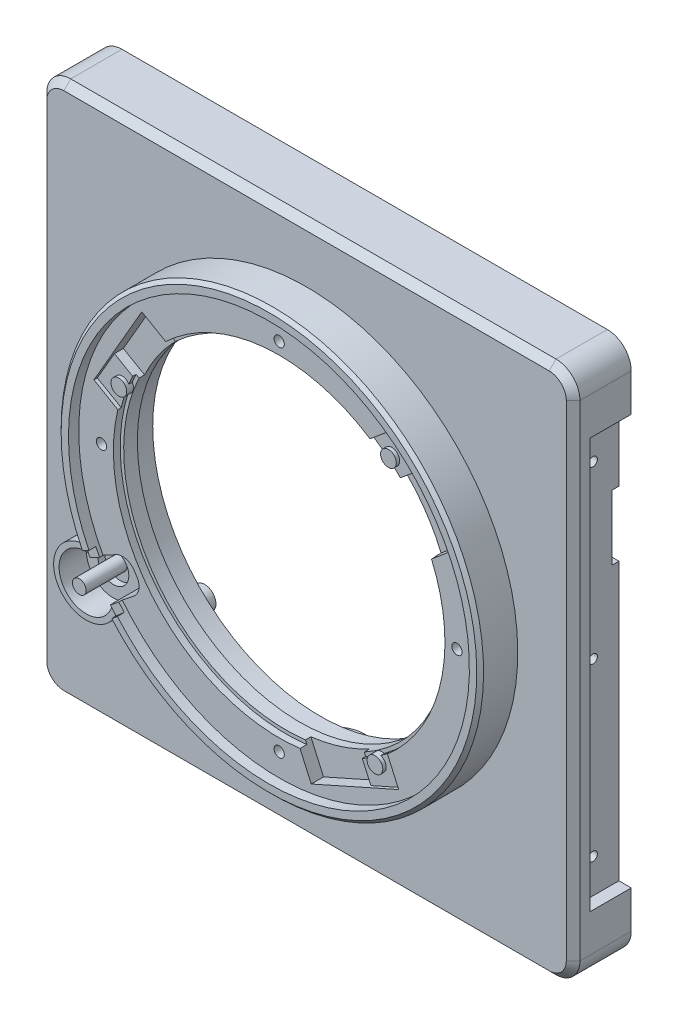
from build123d import *

# Parameters (mm, degrees)
SKETCH_1_W           = 78
SKETCH_1_H           = 78
SKETCH_1_R           = 23.75
EXTRUDE_1_DEPTH      = 2
EXTRUDE_START        = 4
SKETCH_2_R           = 30.9
SKETCH_2_R_2         = 23.750000000000004
EXTRUDE_2_DEPTH      = 4
SKETCH_3_W           = 78
SKETCH_3_H           = 78
SKETCH_3_W_2         = 74.00000000000007
SKETCH_3_H_2         = 73.99999999999996
EXTRUDE_3_DEPTH      = 6.5
SKETCH_4_R           = 0.7500000000000002
SKETCH_4_R_2         = 0.750000000000002
SKETCH_4_R_3         = 0.7500000000000004
CUT_EXTRUDE_1_DEPTH  = 5
CUT_EXTRUDE_2_DEPTH  = 4
EXTRUDE_START_2      = 1.5
EXTRUDE_5_DEPTH      = 1.5
CHAMFER_1_SIZE       = 0.5
SKETCH_9_R           = 1.6499999999999986
SKETCH_9_R_2         = 0.7999999999999987
EXTRUDE_6_DEPTH      = 2.1
CUT_EXTRUDE_START    = -2
SKETCH_9_2_R         = 0.7999999999999987
CUT_EXTRUDE_4_DEPTH  = 2
SKETCH_10_R          = 0.800000000000003
CUT_EXTRUDE_5_DEPTH  = 4
SKETCH_18_R          = 4.25
SKETCH_18_R_2        = 2.5527000000000006
EXTRUDE_9_DEPTH      = 9
SKETCH_18_4_R        = 2.5527000000000006
CUT_EXTRUDE_9_DEPTH  = 7.5
EXTRUDE_10_DEPTH     = 3.9999999999999964
SKETCH_31_R          = 2.2499999999999987
SKETCH_31_R_2        = 1.0000000000000018
CUT_EXTRUDE_19_DEPTH = 1
EXTRUDE_START_3      = 5
SKETCH_32_R          = 1.0000000000000018
EXTRUDE_11_DEPTH     = 5
EXTRUDE_START_4      = 0.5
EXTRUDE_12_DEPTH     = 0.5
FILLET_5_R           = 1
FILLET_2_R           = 1.5
FILLET_3_R           = 3.5
CHAMFER_2_SIZE       = 1
SKETCH_11_R          = 24.25
CUT_EXTRUDE_6_DEPTH  = 1
CUT_EXTRUDE_10_DEPTH = 1.8
SKETCH_12_W          = 29.000000000000004
SKETCH_12_H          = 1
CUT_EXTRUDE_7_DEPTH  = 1
SKETCH_21_R          = 24.5
CUT_EXTRUDE_12_DEPTH = 3
CUT_EXTRUDE_14_DEPTH = 1
SKETCH_24_R          = 0.6500000000000002
SKETCH_24_R_2        = 0.65
CUT_EXTRUDE_15_DEPTH = 4.75
SKETCH_26_R          = 4.25
SKETCH_26_W          = 1.3999999999999995
SKETCH_26_H          = 11.500000000000004
CUT_EXTRUDE_17_DEPTH = 10
SKETCH_29_R          = 0.8000000000000004
SKETCH_29_R_2        = 0.7999999999999987
CUT_EXTRUDE_18_DEPTH = 3
FILLET_6_R           = 0.5
CUT_EXTRUDE_20_DEPTH = 0.5
CUT_EXTRUDE_21_DEPTH = 1.8
SKETCH_35_R          = 1.1500000000000052
SKETCH_35_R_2        = 1.1499999999999992
SKETCH_35_R_3        = 1.1499999999999997
EXTRUDE_13_DEPTH     = 1
SKETCH_36_R          = 5.8
CUT_EXTRUDE_22_DEPTH = 3.9999999999999964
FILLET_7_R           = 0.5


with BuildPart() as part:
    # 草图1 → 凸台-拉伸1 (new body)
    with BuildSketch(Plane.XY):
        Rectangle(SKETCH_1_W, SKETCH_1_H)
        Circle(SKETCH_1_R, mode=Mode.SUBTRACT)
    extrude(amount=-EXTRUDE_1_DEPTH)

    # 草图2 → 凸台-拉伸2 (add)
    with BuildSketch(Plane.XY.offset(EXTRUDE_START)):
        with Locations(Location((0, 0, 0), (0, 0, 180))):
            Circle(SKETCH_2_R)
        Circle(SKETCH_2_R_2, mode=Mode.SUBTRACT)
    extrude(amount=-EXTRUDE_2_DEPTH)

    # 草图3 → 凸台-拉伸3 (add)
    # profile 1 of 6: a face of its own
    with BuildSketch(Plane(origin=(0, 0, -2), x_dir=(-1, 0, 0), z_dir=(0, 0, -1))):
        Rectangle(SKETCH_3_W, SKETCH_3_H)
        Rectangle(SKETCH_3_W_2, SKETCH_3_H_2, mode=Mode.SUBTRACT)
    # profile 2 of 6: a face of its own
    with BuildSketch(Plane(origin=(0, 0, -2), x_dir=(-1, 0, 0), z_dir=(0, 0, -1))):
        Polygon((-37.00000000000004, 37), (-37.00000000000004, 32), (-35.500000000000036, 32), (-32, 32), (-32, 37), align=None)
    # profile 3 of 6: a face of its own
    with BuildSketch(Plane(origin=(0, 0, -2), x_dir=(-1, 0, 0), z_dir=(0, 0, -1))):
        Polygon((-37.00000000000004, 32), (-37.00000000000004, -32.000000000000014), (-35.50000000000003, -32.000000000000014), (-35.500000000000036, 32), align=None)
    # profile 4 of 6: a face of its own
    with BuildSketch(Plane(origin=(0, 0, -2), x_dir=(-1, 0, 0), z_dir=(0, 0, -1))):
        Polygon((-37.00000000000004, -32.000000000000014), (-37.00000000000004, -36.99999999999996), (-32.00000000000001, -36.99999999999996), (-32.00000000000001, -32.000000000000014), (-35.50000000000003, -32.000000000000014), align=None)
    # profile 5 of 6: a face of its own
    with BuildSketch(Plane(origin=(0, 0, -2), x_dir=(-1, 0, 0), z_dir=(0, 0, -1))):
        Polygon((32.000000000000014, -32.000000000000014), (32.000000000000014, -37.00000000000001), (37.00000000000003, -36.99999999999996), (37.00000000000003, -32.000000000000014), align=None)
    # profile 6 of 6: a face of its own
    with BuildSketch(Plane(origin=(0, 0, -2), x_dir=(-1, 0, 0), z_dir=(0, 0, -1))):
        Polygon((31.999999999999993, 32), (36.99999999999999, 32), (37.00000000000003, 37), (31.999999999999986, 37), align=None)
    extrude(amount=EXTRUDE_3_DEPTH)

    # 草图4 → 切除-拉伸1 (cut)
    with BuildSketch(Plane.XY.offset(4)):
        with Locations((6.51e-15, 26)):
            Circle(SKETCH_4_R)
        with Locations((26, 0)):
            Circle(SKETCH_4_R_2)
        with Locations((6.48e-15, -26)):
            Circle(SKETCH_4_R_3)
        with Locations((-26, 0)):
            Circle(SKETCH_4_R_2)
    extrude(amount=-CUT_EXTRUDE_1_DEPTH, mode=Mode.SUBTRACT)

    # 草图5 → 切除-拉伸2 (cut)
    with BuildSketch(Plane.XY.offset(4)):
        with BuildLine():
            Line((-27.97481984312372, -13.719309557873958), (-23.559323960627246, -20.3903961344113))
            Line((-23.559323960627246, -20.3903961344113), (-22.64439875827279, -19.59853609035649))
            Line((-22.64439875827279, -19.59853609035649), (-23.33224850828913, -18.559308480112588))
            Line((-23.33224850828913, -18.559308480112588), (-21.244768304781633, -16.898851750909657))
            ThreePointArc((-21.244768304781633, -16.898851750909657), (-20.5144208968666, -15.64650436728529), (-20.82202593392254, -14.229761466580714))
            Line((-20.82202593392254, -14.229761466580714), (-21.234378184052506, -13.606765174918065))
            ThreePointArc((-21.234378184052506, -13.606765174918065), (-22.41830603698751, -12.770047692990193), (-23.856467348706058, -12.953004920218257))
            Line((-23.856467348706058, -12.953004920218257), (-26.200569322500627, -14.225748447423724))
            Line((-26.200569322500627, -14.225748447423724), (-26.888419072516967, -13.186520837179826))
            Line((-26.888419072516967, -13.186520837179826), (-27.97481984312372, -13.719309557873958))
        make_face()
    extrude(amount=-CUT_EXTRUDE_2_DEPTH, mode=Mode.SUBTRACT)

    # 草图8 → 凸台-拉伸5 (add)
    with BuildSketch(Plane.XY.offset(4).offset(EXTRUDE_START_2)):
        with BuildLine():
            ThreePointArc((30.9, 0), (-6.983586682407516, 30.1004903124401), (-27.74333443684792, -13.605785325559426))
            Line((-27.74333443684792, -13.605785325559431), (-26.888419072516967, -13.186520837179824))
            Line((-26.888419072516967, -13.186520837179824), (-26.329232438853243, -12.91228655896538))
            ThreePointArc((-26.329232438853243, -12.912286558965379), (-6.6276271670420845, 28.56624201981573), (29.325, 0))
            ThreePointArc((29.325, -7.18e-15), (10.24008117356817, -27.479016768413217), (-22.173473149785824, -19.190953949080466))
            Line((-22.17347314978582, -19.190953949080473), (-22.644398758272786, -19.598536090356493))
            Line((-22.644398758272786, -19.598536090356493), (-23.36437579977431, -20.22167014583415))
            ThreePointArc((-23.364375799774322, -20.221670145834146), (10.790059957826307, -28.95487188896738), (30.9, -7.57e-15))
        make_face()
    extrude(amount=-EXTRUDE_5_DEPTH)

    # 倒角1
    chamfer_1_edges = [part.edges().sort_by_distance(p)[0] for p in [
        (25.767071901875468, 17.054852846142637, 5.5),
    ]]
    chamfer(chamfer_1_edges, length=CHAMFER_1_SIZE)

    # 草图9 → 凸台-拉伸6 (add)
    # profile 1 of 3: a face of its own
    with BuildSketch(Plane(origin=(0, 0, -2), x_dir=(-1, 0, 0), z_dir=(0, 0, -1))):
        with Locations((-19, -20)):
            Circle(SKETCH_9_R)
        with Locations((-19, -20)):
            Circle(SKETCH_9_R_2, mode=Mode.SUBTRACT)
    # profile 2 of 3: a face of its own
    with BuildSketch(Plane(origin=(0, 0, -2), x_dir=(-1, 0, 0), z_dir=(0, 0, -1))):
        with Locations((19, 20)):
            Circle(SKETCH_9_R)
        with Locations((19, 20)):
            Circle(SKETCH_9_R_2, mode=Mode.SUBTRACT)
    # profile 3 of 3: a face of its own
    with BuildSketch(Plane(origin=(0, 0, -2), x_dir=(-1, 0, 0), z_dir=(0, 0, -1))):
        with Locations((19, -20)):
            Circle(SKETCH_9_R)
        with Locations((19, -20)):
            Circle(SKETCH_9_R_2, mode=Mode.SUBTRACT)
    extrude(amount=EXTRUDE_6_DEPTH)

    # 草图9<2> → 切除-拉伸4 (cut)
    with BuildSketch(Plane(origin=(0, 0, -2), x_dir=(-1, 0, 0), z_dir=(0, 0, -1)).offset(CUT_EXTRUDE_START)):
        with Locations((-19, -20)):
            Circle(SKETCH_9_2_R)
        with Locations((19, 20)):
            Circle(SKETCH_9_2_R)
        with Locations((19, -20)):
            Circle(SKETCH_9_2_R)
    extrude(amount=CUT_EXTRUDE_4_DEPTH, mode=Mode.SUBTRACT)

    # 草图10 → 切除-拉伸5 (cut)
    with BuildSketch(Plane(origin=(0, 0, -8.5), x_dir=(-1, 0, 0), z_dir=(0, 0, -1))):
        with Locations((-34.50000000000001, 34.5)):
            Circle(SKETCH_10_R)
        with Locations((34.49999999999999, 34.5)):
            Circle(SKETCH_10_R)
        with Locations((34.49999999999999, -34.49999999999999)):
            Circle(SKETCH_10_R)
        with Locations((-34.50000000000001, -34.49999999999999)):
            Circle(SKETCH_10_R)
    extrude(amount=-CUT_EXTRUDE_5_DEPTH, mode=Mode.SUBTRACT)

    # 草图18 → 凸台-拉伸9 (add)
    # profile 1 of 2: a face of its own
    with BuildSketch(Plane.XZ.offset(39)):
        with Locations((0, -4.25)):
            Circle(SKETCH_18_R)
        with Locations((0, -4.25)):
            Circle(SKETCH_18_R_2, mode=Mode.SUBTRACT)
    # profile 2 of 2: a face of its own
    with BuildSketch(Plane.XZ.offset(39)):
        with Locations((0, -4.25)):
            Circle(SKETCH_18_R_2)
    extrude(amount=-EXTRUDE_9_DEPTH)

    # 草图18<4> → 切除-拉伸9 (cut)
    with BuildSketch(Plane.XZ.offset(39)):
        with Locations(Location((0, -4.25, 0), (0, 0, 270))):
            Circle(SKETCH_18_4_R)
    extrude(amount=-CUT_EXTRUDE_9_DEPTH, mode=Mode.SUBTRACT)

    # 草图30 → 凸台-拉伸10 (add)
    with BuildSketch(Plane.XY):
        with BuildLine():
            Line((-26.200569322500627, -14.225748447423724), (-26.888419072516967, -13.186520837179824))
            Line((-26.888419072516967, -13.186520837179824), (-27.743334436847917, -13.605785325559427))
            Line((-27.743334436847917, -13.605785325559427), (-28.44506525893139, -13.949925607014391))
            ThreePointArc((-28.445065258931386, -13.949925607014452), (-27.39391103483802, -14.02285246445049), (-26.38469650504792, -14.325721350646106))
            Line((-26.384696505047916, -14.325721350646141), (-26.200569322500627, -14.225748447423724))
        make_face()
        with BuildLine():
            ThreePointArc((-23.496214450881233, -18.69576150347539), (-23.612418925892246, -19.74000239167697), (-23.955346675130514, -20.733150452847607))
            Line((-23.955346675130457, -20.73315045284763), (-23.36437579977431, -20.22167014583415))
            Line((-23.36437579977431, -20.22167014583415), (-22.64439875827279, -19.59853609035649))
            Line((-22.64439875827279, -19.59853609035649), (-23.33224850828913, -18.559308480112588))
            Line((-23.33224850828913, -18.559308480112588), (-23.49621827274124, -18.689735920005358))
            ThreePointArc((-23.49621827274131, -18.68973592000531), (-23.496215406346348, -18.692748711134325), (-23.496214450881233, -18.69576150347539))
        make_face()
        with BuildLine():
            ThreePointArc((-26.38469650504792, -14.325721350646106), (-27.39391103483802, -14.02285246445049), (-28.445065258931386, -13.949925607014452))
            ThreePointArc((-28.445065258931386, -13.949925607014452), (-32.20717210570015, -21.317462183707647), (-23.955346675130514, -20.733150452847607))
            ThreePointArc((-23.955346675130514, -20.733150452847607), (-23.612418925892246, -19.74000239167697), (-23.496214450881233, -18.69576150347539))
            ThreePointArc((-23.496214450881233, -18.69576150347539), (-23.496215406346348, -18.692748711134325), (-23.49621827274131, -18.68973592000531))
            Line((-23.49621827274124, -18.689735920005358), (-24.354625339008635, -19.37254373163591))
            ThreePointArc((-24.354625339008546, -19.37254373163593), (-31.540063448046517, -20.87591259545785), (-27.34863077133443, -14.849094954603387))
            Line((-27.34863077133438, -14.84909495460317), (-26.384696505047916, -14.325721350646141))
        make_face()
    extrude(amount=EXTRUDE_10_DEPTH)

    # 草图31 → 切除-拉伸19 (cut)
    with BuildSketch(Plane.XY):
        with Locations((-28.246214450881293, -18.695761503475197)):
            Circle(SKETCH_31_R)
        with Locations((-28.246214450881293, -18.695761503475197)):
            Circle(SKETCH_31_R_2, mode=Mode.SUBTRACT)
    extrude(amount=-CUT_EXTRUDE_19_DEPTH, mode=Mode.SUBTRACT)

    # 草图32 → 凸台-拉伸11 (add)
    with BuildSketch(Plane.XY.offset(EXTRUDE_START_3)):
        with Locations((-28.246214450881293, -18.695761503475197)):
            Circle(SKETCH_32_R)
    extrude(amount=-EXTRUDE_11_DEPTH)

    # 草图33 → 凸台-拉伸12 (add)
    with BuildSketch(Plane.XY.offset(4).offset(EXTRUDE_START_4)):
        with BuildLine():
            ThreePointArc((-25.771311828812117, -13.992680644613037), (-26.05587248763348, -13.455375650950238), (-26.329232438853243, -12.912286558965377))
            Line((-26.329232438853243, -12.91228655896538), (-27.74333443684792, -13.605785325559431))
            ThreePointArc((-27.743334436847924, -13.605785325559427), (-27.455292749117636, -14.178042885400254), (-27.15544878125472, -14.744205692021925))
            Line((-27.155448781254716, -14.74420569202192), (-25.771311828812117, -13.992680644613039))
        make_face()
        with BuildLine():
            Line((-23.36437579977431, -20.22167014583415), (-22.17347314978582, -19.190953949080473))
            ThreePointArc((-22.17347314978582, -19.190953949080463), (-22.566579052591102, -18.727122973461682), (-22.949984199697017, -18.255241719398217))
            Line((-22.94998419969701, -18.255241719398217), (-24.182592046739526, -19.23570227210253))
            ThreePointArc((-24.182592046739526, -19.235702272102525), (-23.77859480733383, -19.732927532138685), (-23.364375799774322, -20.22167014583415))
        make_face()
    extrude(amount=-EXTRUDE_12_DEPTH)

    # 圆角5
    fillet_5_edges = [part.edges().sort_by_distance(p)[0] for p in [
        (3.605551275463989, -33.49999999999998, -2),
        (-3.605551275463989, -33.49999999999998, -2),
    ]]
    fillet(fillet_5_edges, radius=FILLET_5_R)

    # 圆角2
    fillet_2_edges = [part.edges().sort_by_distance(p)[0] for p in [
        (32.00000000000001, -32.000000000000014, -5.25),
        (35.50000000000003, -32.000000000000014, -5.25),
        (35.500000000000036, 32, -5.25),
        (32, 32, -5.25),
        (32, 37, -5.25),
        (-31.99999999999999, 37, -5.25),
        (-31.999999999999993, 32, -5.25),
        (-37.000000000000014, 32, -5.25),
        (-37.000000000000014, -32.000000000000014, -5.25),
        (-32.000000000000014, -32.000000000000014, -5.25),
        (-32.000000000000014, -36.999999999999986, -5.25),
        (32.00000000000001, -36.999999999999986, -5.25),
    ]]
    fillet(fillet_2_edges, radius=FILLET_2_R)

    # 圆角3
    fillet_3_edges = [part.edges().sort_by_distance(p)[0] for p in [
        (38.99999999999999, -39, -4.25),
        (-39.00000000000001, -39, -4.25),
        (-39.00000000000001, 39, -4.25),
        (38.99999999999999, 39, -4.25),
    ]]
    fillet(fillet_3_edges, radius=FILLET_3_R)

    # 倒角2
    # the kernel refuses this chamfer: 1 mm, written as the material it takes off along each edge
    with BuildSketch(Plane(origin=(-35.50000000000001, -39, 0), x_dir=(0, -0.02749587661058908, -0.9996219169112968), z_dir=(1, 0, 0))) as chamfer_2_piece_1:
        Polygon((CHAMFER_2_SIZE * 0.999621916911, CHAMFER_2_SIZE * 0.0274958766106), (-CHAMFER_2_SIZE * 0.0274958766106, CHAMFER_2_SIZE * 0.999621916911), (0, 0), align=None)
    extrude(amount=35.50000000000025, mode=Mode.SUBTRACT)
    with BuildSketch(Plane(origin=(38.99999999999999, -35.5, 0), x_dir=(0.02749587661058908, 0, -0.9996219169112968), z_dir=(0, 1, 0)), Plane(origin=(35.49999999999999, 39, 0), x_dir=(0, 0.02749587661058908, -0.9996219169112968), z_dir=(-1, 0, 0)), Plane(origin=(-39.00000000000001, 35.5, 0), x_dir=(-0.02749587661058908, 0, -0.9996219169112968), z_dir=(0, -1, 0))) as chamfer_2_piece_2:
        Polygon((CHAMFER_2_SIZE * 0.999621916911, CHAMFER_2_SIZE * 0.0274958766106), (-CHAMFER_2_SIZE * 0.0274958766106, CHAMFER_2_SIZE * 0.999621916911), (0, 0), align=None)
    extrude(amount=71, mode=Mode.SUBTRACT)
    with BuildSketch(Plane(origin=(35.49999999999999, 35.5, 0), x_dir=(1, 0, 0), z_dir=(0, -1, 0))) as chamfer_2_piece_3:
        Polygon((3.5, -CHAMFER_2_SIZE), (3.5 - CHAMFER_2_SIZE, 0), (3.5, 0), align=None)
    revolve(axis=Axis((35.49999999999999, 35.5, 0), (0, 0, 1)), revolution_arc=90, mode=Mode.SUBTRACT)
    with BuildSketch(Plane(origin=(-35.50000000000001, 35.5, 0), x_dir=(-1, 0, 0), z_dir=(0, -1, 0))) as chamfer_2_piece_4:
        Polygon((3.5, CHAMFER_2_SIZE), (3.5 - CHAMFER_2_SIZE, 0), (3.5, 0), align=None)
    revolve(axis=Axis((-35.50000000000001, 35.5, 0), (0, 0, -1)), revolution_arc=90, mode=Mode.SUBTRACT)
    with BuildSketch(Plane(origin=(-35.50000000000001, -35.5, 0), x_dir=(-1, 0, 0), z_dir=(0, 1, 0))) as chamfer_2_piece_5:
        Polygon((3.5, -CHAMFER_2_SIZE), (3.5 - CHAMFER_2_SIZE, 0), (3.5, 0), align=None)
    revolve(axis=Axis((-35.50000000000001, -35.5, 0), (0, 0, 1)), revolution_arc=90, mode=Mode.SUBTRACT)
    with BuildSketch(Plane(origin=(35.49999999999999, -35.5, 0), x_dir=(0, -1, 0), z_dir=(-1, 0, 0))) as chamfer_2_piece_6:
        Polygon((3.5, -CHAMFER_2_SIZE), (3.5 - CHAMFER_2_SIZE, 0), (3.5, 0), align=None)
    revolve(axis=Axis((35.49999999999999, -35.5, 0), (0, 0, 1)), revolution_arc=90, mode=Mode.SUBTRACT)
    with BuildSketch(Plane(origin=(2.4158e-13, -39, 0), x_dir=(0, -0.02749587661058908, -0.9996219169112968), z_dir=(1, 0, 0))) as chamfer_2_piece_7:
        Polygon((CHAMFER_2_SIZE * 0.999621916911, CHAMFER_2_SIZE * 0.0274958766106), (-CHAMFER_2_SIZE * 0.0274958766106, CHAMFER_2_SIZE * 0.999621916911), (0, 0), align=None)
    extrude(amount=35.49999999999975, mode=Mode.SUBTRACT)

    # 草图11 → 切除-拉伸6 (cut)
    with BuildSketch(Plane.XY.offset(4)):
        Circle(SKETCH_11_R)
    extrude(amount=-CUT_EXTRUDE_6_DEPTH, mode=Mode.SUBTRACT)

    # 草图19 → 切除-拉伸10 (cut)
    with BuildSketch(Plane.ZY.offset(-38.99999999999999)):
        Polygon((-8.5, 30), (-2.500000000000001, 30), (-2.4999999999999933, -30), (-8.499999999999993, -30), align=None)
    extrude(amount=CUT_EXTRUDE_10_DEPTH, mode=Mode.SUBTRACT)

    # 草图12 → 切除-拉伸7 (cut)
    with BuildSketch(Plane(origin=(0, 0, -8.5), x_dir=(-1, 0, 0), z_dir=(0, 0, -1))):
        Polygon((-3.5, -37.999999999999964), (-3.5000000000000013, -36.99999999999996), (-14.5, -36.999999999999964), (-14.500000000000002, -37.999999999999964), align=None)
        Polygon((14.500000000000002, -37.999999999999964), (14.5, -36.999999999999964), (3.5000000000000018, -36.999999999999964), (3.5, -37.999999999999964), align=None)
        with Locations((0, 37.5)):
            Rectangle(SKETCH_12_W, SKETCH_12_H)
    extrude(amount=-CUT_EXTRUDE_7_DEPTH, mode=Mode.SUBTRACT)

    # 草图21 → 切除-拉伸12 (cut)
    with BuildSketch(Plane(origin=(0, 0, -2), x_dir=(-1, 0, 0), z_dir=(0, 0, -1))):
        Circle(SKETCH_21_R)
    extrude(amount=-CUT_EXTRUDE_12_DEPTH, mode=Mode.SUBTRACT)

    # 草图23 → 切除-拉伸14 (cut)
    with BuildSketch(Plane(origin=(0, 0, -8.5), x_dir=(-1, 0, 0), z_dir=(0, 0, -1))):
        Polygon((-35.500000000000036, 19.999999999999996), (-37.19999999999999, 20), (-37.19999999999999, 10.500000000000002), (-35.500000000000036, 10.499999999999996), align=None)
    extrude(amount=-CUT_EXTRUDE_14_DEPTH, mode=Mode.SUBTRACT)

    # 草图24 → 切除-拉伸15 (cut)
    with BuildSketch(Plane(origin=(37.19999999999999, 0, 0), x_dir=(0, 0, -1), z_dir=(1, 0, 0))):
        with Locations((4.700000000000001, -25.000000000000014)):
            Circle(SKETCH_24_R)
        with Locations((4.699999999999915, -1.388e-14)):
            Circle(SKETCH_24_R_2)
        with Locations((4.69999999999983, 24.999999999999986)):
            Circle(SKETCH_24_R)
    extrude(amount=-CUT_EXTRUDE_15_DEPTH, mode=Mode.SUBTRACT)

    # 草图26 → 切除-拉伸17 (cut)
    with BuildSketch(Plane(origin=(-39.00000000000001, 0, 0), x_dir=(0, 0, -1), z_dir=(1, 0, 0))):
        with Locations((9.000000000000002, -10.199999999999994)):
            Circle(SKETCH_26_R)
        with Locations((6.5, -24.25)):
            Rectangle(SKETCH_26_W, SKETCH_26_H)
        with BuildLine():
            Line((12.7, 0.6000000000000073), (7.7, 0.6000000000000066))
            ThreePointArc((7.7, 0.6000000000000066), (5.6, 2.700000000000008), (7.7, 4.800000000000008))
            Line((7.7, 4.800000000000008), (12.7, 4.800000000000008))
            ThreePointArc((12.7, 4.800000000000008), (14.8, 2.700000000000008), (12.7, 0.6000000000000073))
        make_face()
        with BuildLine():
            Line((8.5, 29.5), (8.5, 20.4))
            Line((8.5, 20.4), (6.300000000000001, 20.4))
            ThreePointArc((6.300000000000001, 20.4), (5.4514718625761445, 20.751471862576143), (5.100000000000002, 21.599999999999998))
            Line((5.100000000000002, 21.599999999999998), (5.1000000000000005, 28.299999999999997))
            ThreePointArc((5.1000000000000005, 28.299999999999997), (5.451471862576142, 29.148528137423856), (6.300000000000001, 29.5))
            Line((6.300000000000001, 29.5), (8.5, 29.5))
        make_face()
        Polygon((8.5, 13.999999999999998), (5.100000000000002, 13.999999999999998), (5.100000000000003, 5.999999999999998), (8.500000000000002, 5.999999999999998), align=None)
    extrude(amount=CUT_EXTRUDE_17_DEPTH, mode=Mode.SUBTRACT)

    # 草图29 → 切除-拉伸18 (cut)
    with BuildSketch(Plane(origin=(0, 0, -2), x_dir=(-1, 0, 0), z_dir=(0, 0, -1))):
        with Locations((-15, 22)):
            Circle(SKETCH_29_R)
        with Locations((15, -22)):
            Circle(SKETCH_29_R_2)
    extrude(amount=-CUT_EXTRUDE_18_DEPTH, mode=Mode.SUBTRACT)

    # 圆角6
    fillet_6_edges = [part.edges().sort_by_distance(p)[0] for p in [
        (-23.36437579977402, -20.221670145834494, 1.9999999999999982),
        (-27.743334436847938, -13.605785325559381, 1.9999999999999982),
    ]]
    fillet(fillet_6_edges, radius=FILLET_6_R)

    # 草图34 → 切除-拉伸20 (cut)
    with BuildSketch(Plane.XY.offset(4)):
        with BuildLine():
            Line((17.478391727313628, -22.046957219230375), (15.838315503483965, -18.36328570850293))
            ThreePointArc((15.83831550348363, -18.363285708502985), (13.823905584345479, -19.92390861239586), (11.656851981138184, -21.264531546446886))
            Line((11.65685198113835, -21.26453154644683), (12.910664439100614, -24.08064043460935))
            Line((12.910664439100614, -24.08064043460935), (17.478391727313628, -22.046957219230375))
        make_face()
        with BuildLine():
            Line((15.838315503483965, -18.36328570850293), (15.24134019039676, -17.02245720219606))
            Line((15.24134019039676, -17.02245720219606), (10.673612902183741, -19.056140417575033))
            Line((10.673612902183741, -19.056140417575033), (11.65685198113835, -21.26453154644683))
            ThreePointArc((11.656851981138184, -21.264531546446886), (13.823905584345479, -19.92390861239586), (15.83831550348363, -18.363285708502985))
        make_face()
        with BuildLine():
            ThreePointArc((13.286291757179338, 20.28637353848904), (15.341705400138268, 18.780164413959966), (17.227715800439647, 17.066584552841324))
            Line((17.227715800440052, 17.06658455284075), (19.5891358556191, 19.048051250196117))
            Line((19.5891358556191, 19.048051250196117), (16.375197807186417, 22.878273465791008))
            Line((16.375197807186417, 22.878273465791008), (13.286291757179416, 20.286373538488878))
        make_face()
        with BuildLine():
            Line((15.37589141846472, 15.512719396920158), (17.227715800440052, 17.06658455284075))
            ThreePointArc((17.227715800439647, 17.066584552841324), (15.341705400138268, 18.780164413959966), (13.286291757179338, 20.28637353848904))
            Line((13.286291757179416, 20.286373538488878), (12.16195337003203, 19.342941612515055))
            Line((12.16195337003203, 19.342941612515055), (15.375891418464722, 15.512719396920158))
        make_face()
        with BuildLine():
            Line((-27.099192253125917, 7.562822173509051), (-23.60713492768148, 5.54668193663808))
            ThreePointArc((-23.60713492768187, 5.546681936637684), (-22.894754196759738, 7.993292830239138), (-21.929569393563796, 10.351641715827979))
            Line((-21.929569393563657, 10.35164171582818), (-24.599192253125896, 11.892949192431232))
            Line((-24.599192253125896, 11.892949192431233), (-27.099192253125917, 7.562822173509051))
        make_face()
        with BuildLine():
            ThreePointArc((-21.929569393563796, 10.351641715827979), (-22.894754196759738, 7.993292830239138), (-23.60713492768187, 5.546681936637684))
            Line((-23.60713492768148, 5.54668193663808), (-22.336052532311516, 4.812822173509032))
            Line((-22.336052532311516, 4.812822173509032), (-19.8360525323115, 9.142949192431214))
            Line((-19.8360525323115, 9.142949192431214), (-21.929569393563657, 10.35164171582818))
        make_face()
    extrude(amount=-CUT_EXTRUDE_20_DEPTH, mode=Mode.SUBTRACT)

    # 草图34<3> → 切除-拉伸21 (cut)
    with BuildSketch(Plane.XY.offset(4)):
        with BuildLine():
            Line((11.65685198113835, -21.26453154644683), (10.673612902183741, -19.056140417575033))
            Line((10.673612902183741, -19.056140417575033), (2.4517037834003172, -22.716770205257184))
            Line((2.451703783400318, -22.716770205257184), (3.0486790964874735, -24.057598711563944))
            ThreePointArc((3.048679096487558, -24.057598711563877), (7.484214528991522, -23.066188087415576), (11.656851981138184, -21.264531546446886))
        make_face()
        with BuildLine():
            Line((12.910664439100614, -24.08064043460935), (11.65685198113835, -21.26453154644683))
            ThreePointArc((11.656851981138184, -21.264531546446886), (7.484214528991522, -23.066188087415576), (3.048679096487558, -24.057598711563877))
            Line((3.0486790964874735, -24.057598711563944), (4.688755320317184, -27.741270222291504))
            Line((4.688755320317184, -27.741270222291504), (12.910664439100614, -24.08064043460935))
        make_face()
        with BuildLine():
            Line((-24.599192253125896, 11.892949192431232), (-21.929569393563657, 10.35164171582818))
            ThreePointArc((-21.929569393563796, 10.351641715827979), (-19.612821927889172, 14.261827233033978), (-16.607134927681265, 17.671037589620735))
            Line((-16.607134927681418, 17.671037589620184), (-20.09919225312586, 19.687177826491162))
            Line((-20.09919225312586, 19.687177826491162), (-24.599192253125896, 11.892949192431233))
        make_face()
        with BuildLine():
            ThreePointArc((-16.607134927681265, 17.671037589620735), (-19.612821927889172, 14.261827233033978), (-21.929569393563796, 10.351641715827979))
            Line((-21.929569393563657, 10.35164171582818), (-19.8360525323115, 9.142949192431214))
            Line((-19.8360525323115, 9.142949192431214), (-18.836052532311488, 10.875000000000089))
            Line((-18.836052532311488, 10.875000000000089), (-15.336052532311461, 16.937177826491137))
            Line((-15.336052532311461, 16.937177826491137), (-16.607134927681418, 17.671037589620184))
        make_face()
        with BuildLine():
            ThreePointArc((17.227715800439647, 17.066584552841324), (20.10971397660282, 13.552191844097592), (22.285318292791214, 9.561751334822787))
            Line((22.285318292790826, 9.561751334823066), (25.374224342797945, 12.153651262125305))
            Line((25.374224342797945, 12.153651262125305), (19.5891358556191, 19.048051250196117))
            Line((19.5891358556191, 19.048051250196117), (17.227715800440052, 17.06658455284075))
        make_face()
        with BuildLine():
            Line((21.160979905643565, 8.618319408849345), (22.285318292790826, 9.561751334823066))
            ThreePointArc((22.285318292791214, 9.561751334822787), (20.10971397660282, 13.552191844097592), (17.227715800439647, 17.066584552841324))
            Line((17.227715800440052, 17.06658455284075), (15.37589141846472, 15.512719396920158))
            Line((15.375891418464722, 15.512719396920158), (16.661466637837798, 13.9806305106822))
            Line((16.661466637837798, 13.9806305106822), (21.160979905643565, 8.618319408849345))
        make_face()
    extrude(amount=-CUT_EXTRUDE_21_DEPTH, mode=Mode.SUBTRACT)

    # 草图35 → 凸台-拉伸13 (add)
    with BuildSketch(Plane.XY.offset(3)):
        with Locations(Location((14.004984601138217, -20.637899755592418, 0), (0, 0, 176.154356365))):
            Circle(SKETCH_35_R)
        with Locations(Location((15.97812559595017, 19.15103136752801, 0), (0, 0, 178.167676817))):
            Circle(SKETCH_35_R_2)
        with Locations(Location((-23.46092366290794, 8.464488223348578, 0), (0, 0, 288.167676817))):
            Circle(SKETCH_35_R_3)
    extrude(amount=EXTRUDE_13_DEPTH)

    # 草图36 → 切除-拉伸22 (cut)
    with BuildSketch(Plane(origin=(0, 0, -8.5), x_dir=(-1, 0, 0), z_dir=(0, 0, -1))):
        with Locations((44.00000000000001, -24.25)):
            Circle(SKETCH_36_R)
    extrude(amount=-CUT_EXTRUDE_22_DEPTH, mode=Mode.SUBTRACT)

    # 圆角7
    fillet_7_edges = [part.edges().sort_by_distance(p)[0] for p in [
        (-38.20000000000001, -24.25, -4.5000000000000036),
    ]]
    fillet(fillet_7_edges, radius=FILLET_7_R)


solid = part.part
